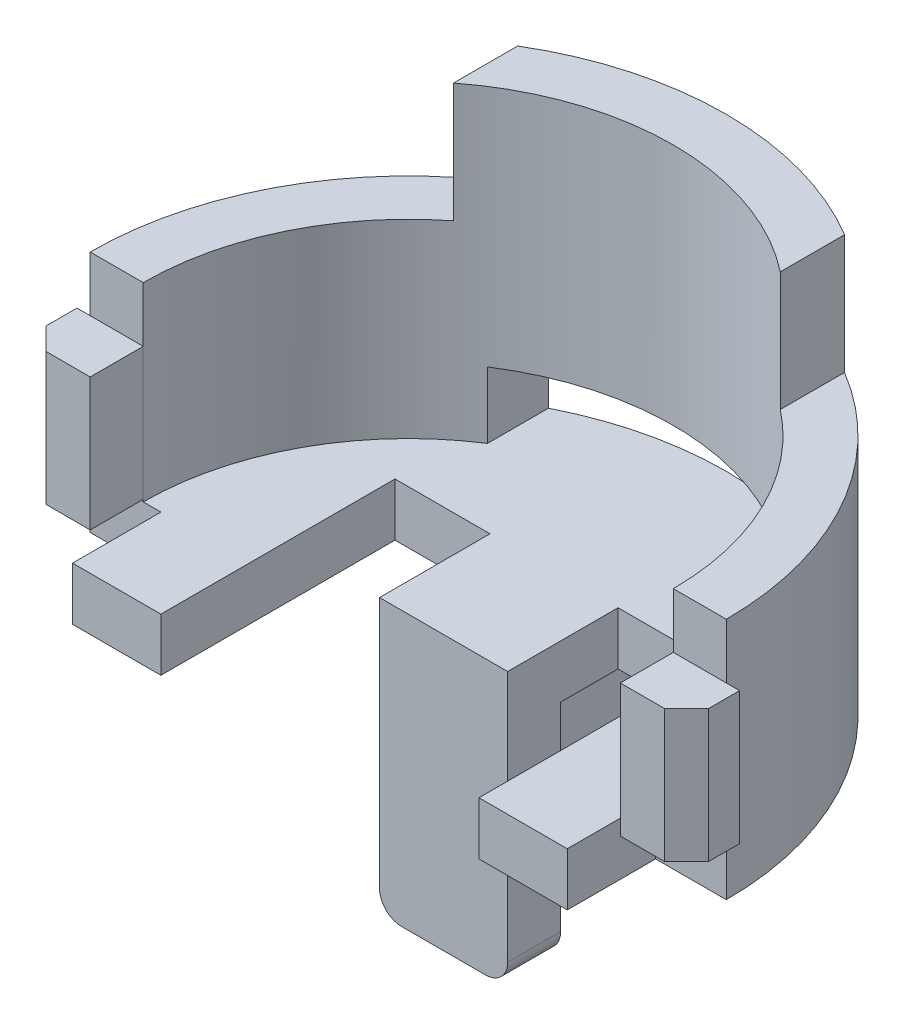
from build123d import *

# Parameters (mm, degrees)
SKETCH1_W                = 6
SKETCH1_H                = 1.2
SKETCH1_W_2              = 1.2
SKETCH1_H_2              = 4.3
REVOLVE1_ANGLE           = 180
REVOLVE2_START           = 4.3
REVOLVE2_DEPTH           = 2.7
SKETCH3_W                = 6.5
SKETCH3_H                = 1.5
CUT_EXTRUDE1_DEPTH       = 10
CUT_EXTRUDE2_DEPTH       = 10
SKETCH5_W                = 2
SKETCH5_H                = 2
BOSS_EXTRUDE1_DEPTH      = 1.2
SKETCH6_W                = 1.2
SKETCH6_H                = 3
BOSS_EXTRUDE2_DEPTH      = 1.5
CHAMFER1_SIZE            = 0.5
CHAMFER1_OF_MIRROR1_SIZE = 0.5
SKETCH7_W                = 2.9
SKETCH7_H                = 1.2
BOSS_EXTRUDE3_DEPTH      = 5
BOSS_EXTRUDE4_DEPTH      = 0.6
FILLET1_R                = 0.5


# Read off the part's stored shape, not the designer's step: Revolve2
with BuildPart() as part:
    # Sketch1 → Revolve1 (revolve)
    with BuildSketch(Plane.XY):
        with Locations((3, -0.6)):
            Rectangle(SKETCH1_W, SKETCH1_H)
        with Locations((6.6, -0.6)):
            Rectangle(SKETCH1_W_2, SKETCH1_H)
        with Locations((6.6, 2.15)):
            Rectangle(SKETCH1_W_2, SKETCH1_H_2)
    revolve(axis=Axis((0, -1.2, 0), (0, 1, 0)), revolution_arc=REVOLVE1_ANGLE)

    # Revolve2 outline → Revolve2 (add)
    with BuildSketch(Plane(origin=(0, 0, 0), x_dir=(1, 0, 0), z_dir=(0, 1, 0)).offset(REVOLVE2_START)):
        with BuildLine():
            ThreePointArc((3.7, 6.176568627), (0, 7.2), (-3.7, 6.176568627))
            Line((-3.7, 6.176568627), (-3.7, 4.723346271))
            ThreePointArc((-3.7, 4.723346271), (0, 6), (3.7, 4.723346271))
            Line((3.7, 4.723346271), (3.7, 6.176568627))
        make_face()
    extrude(amount=REVOLVE2_DEPTH)

    # Sketch3 → Cut-Extrude1 (cut)
    with BuildSketch(Plane.XY):
        with Locations((0, 0.75)):
            Rectangle(SKETCH3_W, SKETCH3_H)
    extrude(amount=-CUT_EXTRUDE1_DEPTH, mode=Mode.SUBTRACT)

    # Sketch4 → Cut-Extrude2 (cut)
    with BuildSketch(Plane(origin=(0, 0, 0), x_dir=(1, 0, 0), z_dir=(0, 1, 0))):
        Polygon((-1.45, 3.3), (-3.6, 3.3), (-3.6, 0), (3.6, 0), (3.6, 3.3), (1.45, 3.3), (1.45, 0.8), (-1.45, 0.8), align=None)
    extrude(amount=-CUT_EXTRUDE2_DEPTH, mode=Mode.SUBTRACT)

    # Sketch5 → Boss-Extrude1 (add)
    with BuildSketch(Plane(origin=(0, 0, 0), x_dir=(1, 0, 0), z_dir=(0, 1, 0))):
        with Locations((-4.6, -1)):
            Rectangle(SKETCH5_W, SKETCH5_H)
        with Locations((4.6, -1)):
            Rectangle(SKETCH5_W, SKETCH5_H)
    extrude(amount=-BOSS_EXTRUDE1_DEPTH)

    # Sketch6 → Boss-Extrude2 (add)
    with BuildSketch(Plane(origin=(6, 0, 0), x_dir=(0, 0, -1), z_dir=(1, 0, 0))):
        with Locations((-0.6, 1.55)):
            Rectangle(SKETCH6_W, SKETCH6_H)
    boss_extrude2 = extrude(amount=BOSS_EXTRUDE2_DEPTH)

    # Chamfer1
    chamfer1_edges = [part.edges().sort_by_distance(p)[0] for p in [
        (7.5, 1.55, 1.2),
    ]]
    chamfer(chamfer1_edges, length=CHAMFER1_SIZE)

    # Mirror1: Boss-Extrude2 across plane
    add(boss_extrude2.mirror(Plane(origin=(0, 0, 0), x_dir=(0, 0, 1), z_dir=(1, 0, 0))))

    # Chamfer1 of Mirror1
    chamfer1_of_mirror1_edges = [part.edges().sort_by_distance(p)[0] for p in [
        (-7.5, 1.55, 1.2),
    ]]
    chamfer(chamfer1_of_mirror1_edges, length=CHAMFER1_OF_MIRROR1_SIZE)

    # Sketch7 → Boss-Extrude3 (add)
    with BuildSketch(Plane.XZ.offset(1.2)):
        with Locations((0, -1.4)):
            Rectangle(SKETCH7_W, SKETCH7_H)
    extrude(amount=BOSS_EXTRUDE3_DEPTH)

    # Sketch8 → Boss-Extrude4 (add, symmetric)
    with BuildSketch(Plane(origin=(0, 0, 0), x_dir=(0, 0, -1), z_dir=(1, 0, 0))):
        Polygon((2, -6.2), (6, -1.2), (2, -1.2), align=None)
    extrude(amount=BOSS_EXTRUDE4_DEPTH, both=True)

    # Fillet1
    fillet1_edges = [part.edges().sort_by_distance(p)[0] for p in [
        (-1.45, -6.2, -1.4),
        (1.45, -6.2, -1.4),
    ]]
    fillet(fillet1_edges, radius=FILLET1_R)


solid = part.part
